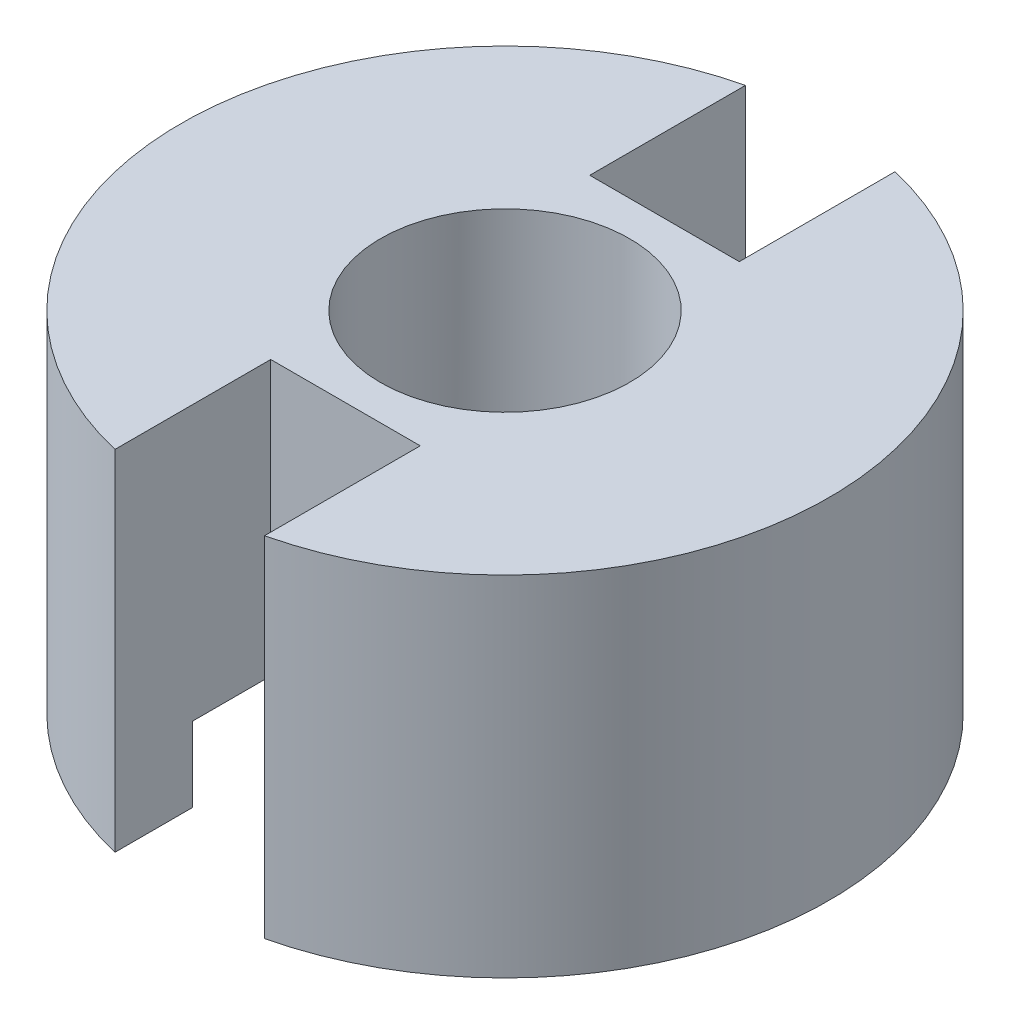
from build123d import *

# Parameters (mm, degrees)
SKETCH1_R           = 6.5
BOSS_EXTRUDE1_DEPTH = 7
SKETCH2_R           = 5
CUT_EXTRUDE1_DEPTH  = 1.5
SKETCH3_R           = 2.5
SKETCH3_W           = 3
SKETCH3_H           = 3.5
CUT_EXTRUDE2_DEPTH  = 12.554220008
BOSS_EXTRUDE2_DEPTH = 1.5


with BuildPart() as part:
    # Sketch1 → Boss-Extrude1 (new body)
    with BuildSketch(Plane(origin=(0, 0, 0), x_dir=(1, 0, 0), z_dir=(0, 1, 0))):
        Circle(SKETCH1_R)
    extrude(amount=BOSS_EXTRUDE1_DEPTH)

    # Sketch2 → Cut-Extrude1 (cut)
    with BuildSketch(Plane.XZ):
        Circle(SKETCH2_R)
    extrude(amount=-CUT_EXTRUDE1_DEPTH, mode=Mode.SUBTRACT)

    # Sketch3 → Cut-Extrude2 (cut, through all)
    with BuildSketch(Plane(origin=(0, 7, 0), x_dir=(1, 0, 0), z_dir=(0, 1, 0))):
        Circle(SKETCH3_R)
        with Locations((0, 4.95)):
            Rectangle(SKETCH3_W, SKETCH3_H)
        with Locations((0, -4.95)):
            Rectangle(SKETCH3_W, SKETCH3_H)
    extrude(amount=-CUT_EXTRUDE2_DEPTH, mode=Mode.SUBTRACT)

    # Sketch4 → Boss-Extrude2 (add)
    with BuildSketch(Plane.XZ.offset(-1.5)):
        with BuildLine():
            Line((-1.5, 2), (-1.5, 3.2))
            Line((-1.5, 3.2), (1.5, 3.2))
            Line((1.5, 3.2), (1.5, 2))
            ThreePointArc((1.5, 2), (0, 2.5), (-1.5, 2))
        make_face()
        with BuildLine():
            Line((-1.5, -2), (-1.5, -3.2))
            Line((-1.5, -3.2), (1.5, -3.2))
            Line((1.5, -3.2), (1.5, -2))
            ThreePointArc((1.5, -2), (0, -2.5), (-1.5, -2))
        make_face()
    extrude(amount=BOSS_EXTRUDE2_DEPTH)


solid = part.part
